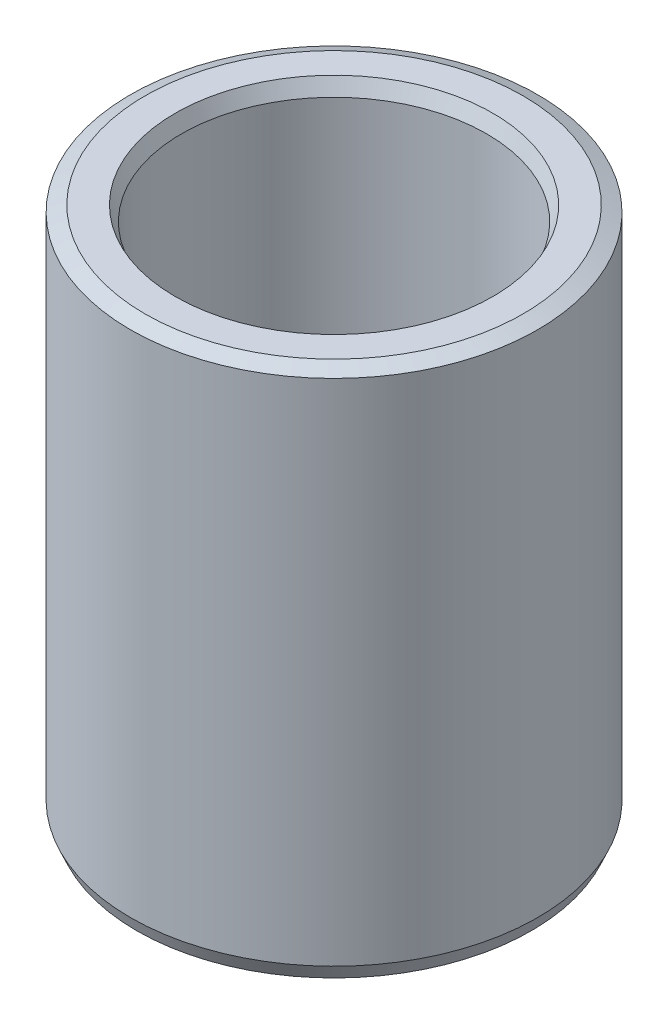
from build123d import *
from OCP.BRepFilletAPI import BRepFilletAPI_MakeChamfer

# Parameters (mm, degrees)
SKETCH1_R           = 35
BOSS_EXTRUDE1_DEPTH = 91.10936795
SKETCH2_R           = 26.215124682
CUT_EXTRUDE1_DEPTH  = 104.686628493
CHAMFER1_SIZE       = 1.088469799
CHAMFER1_SIZE2      = 2.516314558


with BuildPart() as part:
    # Sketch1 → Boss-Extrude1 (new body)
    with BuildSketch(Plane(origin=(0, 0, 0), x_dir=(1, 0, 0), z_dir=(0, 1, 0))):
        Circle(SKETCH1_R)
    extrude(amount=BOSS_EXTRUDE1_DEPTH)

    # Sketch2 → Cut-Extrude1 (cut, through all)
    with BuildSketch(Plane(origin=(0, 0, 0), x_dir=(1, 0, 0), z_dir=(0, 1, 0))):
        Circle(SKETCH2_R)
    extrude(amount=CUT_EXTRUDE1_DEPTH, mode=Mode.SUBTRACT)

    # Chamfer1: one chamfer whose edges measure the first distance from different faces: ONE call of the kernel's chamfer builder (chamfer() names one face for all edges)
    chamfer1_edges_1 = [part.edges().sort_by_distance(p)[0] for p in [
        (-26.215124682, 91.10936795, 0),
    ]]
    chamfer1_side_1 = [part.faces().sort_by_distance(p)[0] for p in [
        (-34.010050506, 91.10936795, 0),
    ]]
    chamfer1_edges_2 = [part.edges().sort_by_distance(p)[0] for p in [
        (-26.215124682, 0, 0),
    ]]
    chamfer1_side_2 = [part.faces().sort_by_distance(p)[0] for p in [
        (-26.215124682, 45.554683975, 0),
    ]]
    chamfer1_edges_3 = [part.edges().sort_by_distance(p)[0] for p in [
        (-35, 0, 0),
    ]]
    chamfer1_side_3 = [part.faces().sort_by_distance(p)[0] for p in [
        (-34.010050506, 0, 0),
    ]]
    chamfer1_edges_4 = [part.edges().sort_by_distance(p)[0] for p in [
        (-35, 91.10936795, 0),
    ]]
    chamfer1_side_4 = [part.faces().sort_by_distance(p)[0] for p in [
        (-35, 45.554683975, 0),
    ]]
    chamfer1 = BRepFilletAPI_MakeChamfer(part.part.solid().wrapped)
    for e in chamfer1_edges_1:
        chamfer1.Add(CHAMFER1_SIZE, CHAMFER1_SIZE2, e.wrapped, chamfer1_side_1[0].wrapped)  # the first distance lies on this face
    for e in chamfer1_edges_2:
        chamfer1.Add(CHAMFER1_SIZE, CHAMFER1_SIZE2, e.wrapped, chamfer1_side_2[0].wrapped)  # the first distance lies on this face
    for e in chamfer1_edges_3:
        chamfer1.Add(CHAMFER1_SIZE, CHAMFER1_SIZE2, e.wrapped, chamfer1_side_3[0].wrapped)  # the first distance lies on this face
    for e in chamfer1_edges_4:
        chamfer1.Add(CHAMFER1_SIZE, CHAMFER1_SIZE2, e.wrapped, chamfer1_side_4[0].wrapped)  # the first distance lies on this face
    add(Compound.cast(chamfer1.Shape()), mode=Mode.REPLACE)


solid = part.part
